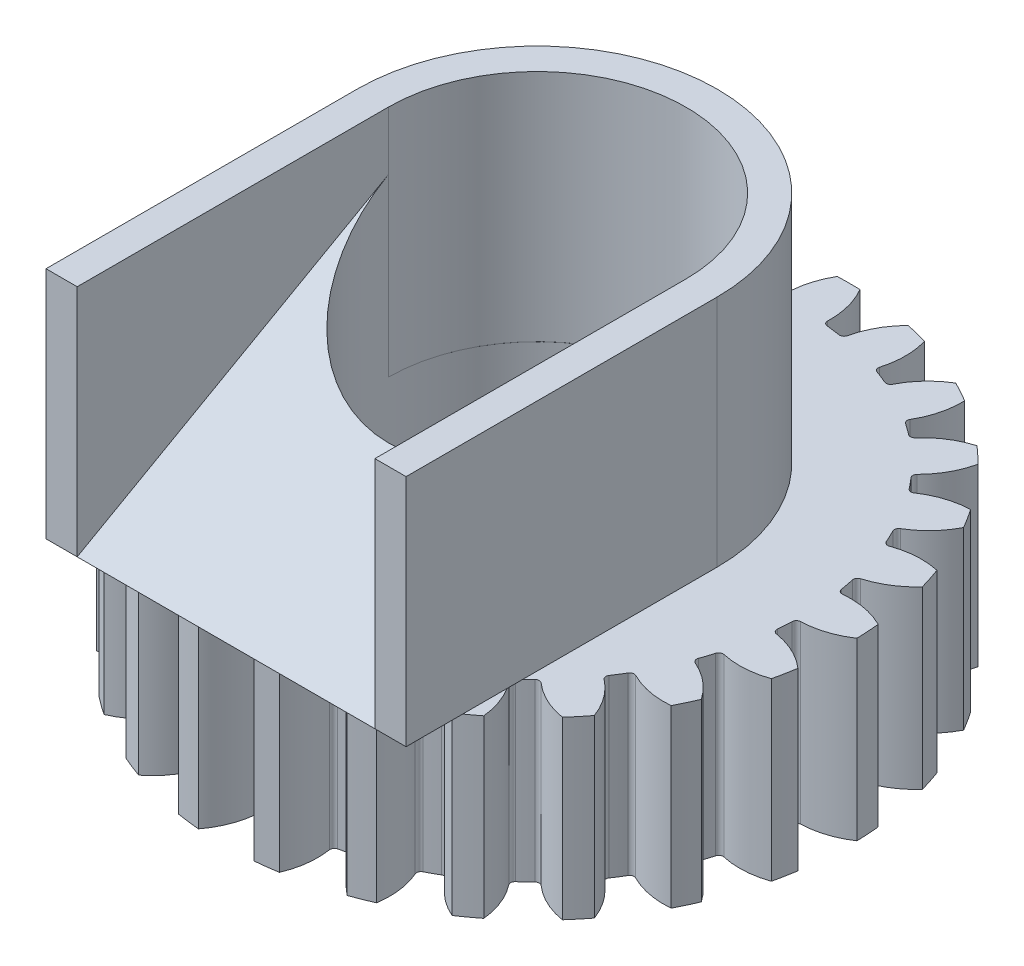
from build123d import *
from build123d.topology import SkipClean

# Parameters (mm, degrees)
SKETCH3_W                = 20.95
SKETCH3_H                = 22.5
CUT_EXTRUDE1_DEPTH       = 75.848129981
FILLET1_R                = 0.57
CIRPATTERN1_COUNT        = 25
FILLET1_OF_CIRPATTERN1_R = 0.57
BOSS_EXTRUDE1_DEPTH      = 30
BOSS_EXTRUDE2_DEPTH      = 39
SKETCH9_R                = 19.05
CUT_EXTRUDE2_DEPTH       = 78.423121144


with BuildPart() as part:
    # Sketch3 → Revolve1 (revolve)
    with BuildSketch(Plane.XY):
        with Locations((10.398080905, 14.564536648)):
            Rectangle(SKETCH3_W, SKETCH3_H)
    revolve(axis=Axis((-19.126919095, 24.943438473, 0), (0, -1, 0)))

    # Sketch5 → Cut-Extrude1 (cut, through all)
    with BuildSketch(Plane.XZ.offset(-3.314536648)):
        with BuildLine():
            ThreePointArc((-15.560842547, 39.840721606), (-19.126919095, 40), (-22.692995643, 39.840721606))
            ThreePointArc((-22.692995643, 39.840721606), (-21.170423487, 37.070640404), (-20.556207552, 33.969944576))
            ThreePointArc((-20.556207552, 33.969944576), (-19.126919095, 34), (-17.697630638, 33.969944576))
            ThreePointArc((-17.697630638, 33.969944576), (-17.083414703, 37.070640404), (-15.560842547, 39.840721606))
        make_face()
    cut_extrude1 = extrude(amount=-CUT_EXTRUDE1_DEPTH, mode=Mode.SUBTRACT)

    # Fillet1
    fillet1_edges = [part.edges().sort_by_distance(p)[0] for p in [
        (-20.556207552, 14.564536648, 33.969944576),
        (-17.697630638, 14.564536648, 33.969944576),
    ]]
    fillet(fillet1_edges, radius=FILLET1_R)

    # CirPattern1: Cut-Extrude1 ×25 about axis
    cirpattern1_axis = Axis((-19.126919095, 25.814536648, 0), (0, 1, 0))
    for i in range(1, CIRPATTERN1_COUNT):
        add(cut_extrude1.rotate(cirpattern1_axis, i * 360 / CIRPATTERN1_COUNT), mode=Mode.SUBTRACT)

    # Fillet1 of CirPattern1
    fillet1_of_cirpattern1_edges = [part.edges().sort_by_distance(p)[0] for p in [
        (-12.063322143, 14.564536648, 33.258165886),
        (-9.294552679, 14.564536648, 32.547266716),
        (-4.014268509, 14.564536648, 30.456654318),
        (-1.509278464, 14.564536648, 29.079524387),
        (3.085201708, 14.564536648, 25.741439148),
        (5.169014598, 14.564536648, 23.784608594),
        (8.789002685, 14.564536648, 19.408794686),
        (10.320704792, 14.564536648, 16.99521837),
        (12.738743629, 14.564536648, 11.856624273),
        (13.622092476, 14.564536648, 9.137956071),
        (14.68624779, 14.564536648, 3.559458551),
        (14.86573932, 14.564536648, 0.706522385),
        (14.50914632, 14.564536648, -4.961361042),
        (13.97350242, 14.564536648, -7.7693047),
        (12.218567155, 14.564536648, -13.170440074),
        (11.001444302, 14.564536648, -15.756957798),
        (7.958435808, 14.564536648, -20.551971919),
        (6.136310306, 14.564536648, -22.754543287),
        (1.996432, 14.564536648, -26.642147784),
        (-0.316205304, 14.564536648, -28.322377137),
        (-5.292829644, 14.564536648, -31.05829952),
        (-7.950667242, 14.564536648, -32.110611868),
        (-13.451338006, 14.564536648, -33.522944073),
        (-16.287374188, 14.564536648, -33.881218761),
        (-21.966464002, 14.564536648, -33.881218761),
        (-24.802500184, 14.564536648, -33.522944073),
        (-30.303170948, 14.564536648, -32.110611868),
        (-32.961008546, 14.564536648, -31.05829952),
        (-37.937632886, 14.564536648, -28.322377137),
        (-40.25027019, 14.564536648, -26.642147784),
        (-44.390148496, 14.564536648, -22.754543287),
        (-46.212273998, 14.564536648, -20.551971919),
        (-49.255282491, 14.564536648, -15.756957798),
        (-50.472405345, 14.564536648, -13.170440074),
        (-52.22734061, 14.564536648, -7.7693047),
        (-52.76298451, 14.564536648, -4.961361042),
        (-53.11957751, 14.564536648, 0.706522385),
        (-52.94008598, 14.564536648, 3.559458551),
        (-51.875930665, 14.564536648, 9.137956071),
        (-50.992581819, 14.564536648, 11.856624273),
        (-48.574542982, 14.564536648, 16.99521837),
        (-47.042840875, 14.564536648, 19.408794686),
        (-43.422852788, 14.564536648, 23.784608594),
        (-41.339039898, 14.564536648, 25.741439148),
        (-36.744559726, 14.564536648, 29.079524387),
        (-34.239569681, 14.564536648, 30.456654318),
        (-28.959285511, 14.564536648, 32.547266716),
        (-26.190516046, 14.564536648, 33.258165886),
    ]]
    fillet(fillet1_of_cirpattern1_edges, radius=FILLET1_OF_CIRPATTERN1_R)

    # Sketch6 → Boss-Extrude1 (add)
    with BuildSketch(Plane(origin=(0, 25.814536648, 0), x_dir=(1, 0, 0), z_dir=(0, 1, 0))):
        with BuildLine():
            Line((-42.176919095, 0), (-42.176919095, -39.901687621))
            Line((-42.176919095, -39.901687621), (-38.176919095, -39.901687621))
            Line((-38.176919095, -39.901687621), (-38.176919095, 0))
            ThreePointArc((-38.176919095, 0), (-19.088459547, 19.088459547), (0, 0))
            Line((0, 0), (0, -39.901687621))
            Line((0, -39.901687621), (4, -39.901687621))
            Line((4, -39.901687621), (4, 0))
            ThreePointArc((4, 0), (-19.088459547, 23.088459547), (-42.176919095, 0))
        make_face()
    extrude(amount=BOSS_EXTRUDE1_DEPTH)

    # Sketch8 → Boss-Extrude2 (add)
    with BuildSketch(Plane(origin=(-38.176919095, 0, 0), x_dir=(0, 0, -1), z_dir=(1, 0, 0))):
        Polygon((0, 25.814536648), (-39.901687621, 25.814536648), (0, 48.314536648), align=None)
    extrude(amount=BOSS_EXTRUDE2_DEPTH)

    # Sketch9 → Cut-Extrude2 (cut, through all)
    with SkipClean():  # the faces are left unmerged after this step: merging them gives an invalid solid
        with BuildSketch(Plane(origin=(0, 25.814536648, 0), x_dir=(-1, 0, 0), z_dir=(0, -1, 0))):
            with Locations((19.126919095, 0)):
                Circle(SKETCH9_R)
        extrude(amount=-CUT_EXTRUDE2_DEPTH, mode=Mode.SUBTRACT)


solid = part.part
